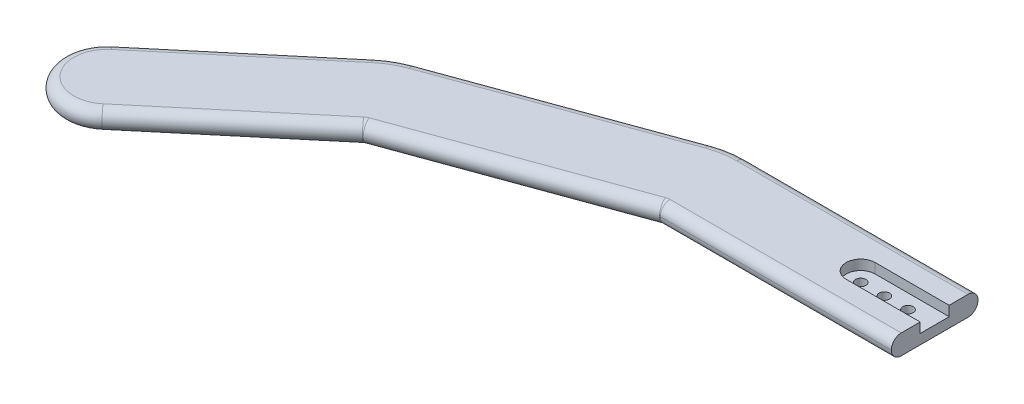
from build123d import *

# Parameters (mm, degrees)
SKETCH1_W           = 25.4
SKETCH1_H           = 9.525
BOSS_EXTRUDE1_DEPTH = 1.0922
BOSS_EXTRUDE2_DEPTH = 1.0922
FILLET1_R           = 1.0922
SKETCH3_R           = 0.575
CUT_EXTRUDE1_DEPTH  = 28.149190151
REVOLVE1_ANGLE      = 20
BOSS_EXTRUDE3_DEPTH = 25.4
REVOLVE2_ANGLE      = 20
BOSS_EXTRUDE4_DEPTH = 20.32
REVOLVE3_ANGLE      = 180


with BuildPart() as part:
    # Sketch1 → Boss-Extrude1 (new body)
    with BuildSketch(Plane(origin=(0, 0, 0), x_dir=(1, 0, 0), z_dir=(0, 1, 0))):
        with Locations((-12.7, -4.7625)):
            Rectangle(SKETCH1_W, SKETCH1_H)
    extrude(amount=BOSS_EXTRUDE1_DEPTH)

    # Sketch2 → Boss-Extrude2 (add)
    with BuildSketch(Plane(origin=(0, 1.0922, 0), x_dir=(1, 0, 0), z_dir=(0, 1, 0))):
        with BuildLine():
            Line((-8.128, -3.16865), (0, -3.16865))
            Line((0, -3.16865), (0, 0))
            Line((0, 0), (-25.4, 0))
            Line((-25.4, 0), (-25.4, -9.525))
            Line((-25.4, -9.525), (0, -9.525))
            Line((0, -9.525), (0, -6.35635))
            Line((0, -6.35635), (-8.128, -6.35635))
            ThreePointArc((-8.128, -6.35635), (-9.72185, -4.7625), (-8.128, -3.16865))
        make_face()
    extrude(amount=BOSS_EXTRUDE2_DEPTH)

    # Fillet1
    fillet1_edges = [part.edges().sort_by_distance(p)[0] for p in [
        (-12.7, 0, 0),
        (-12.7, 2.1844, 0),
        (-12.7, 0, 9.525),
        (-12.7, 2.1844, 9.525),
    ]]
    fillet(fillet1_edges, radius=FILLET1_R - 0.0001)  # a hair under: the kernel refuses the full size

    # Sketch3 → Cut-Extrude1 (cut, through all)
    with BuildSketch(Plane(origin=(0, 1.0922, 0), x_dir=(1, 0, 0), z_dir=(0, 1, 0))):
        with Locations(Location((-8.128, -4.7625, 0), (0, 0, 270))):
            Circle(SKETCH3_R)
        with Locations(Location((-5.528, -4.7625, 0), (0, 0, 270))):
            Circle(SKETCH3_R)
        with Locations(Location((-2.928, -4.7625, 0), (0, 0, 270))):
            Circle(SKETCH3_R)
    extrude(amount=-CUT_EXTRUDE1_DEPTH, mode=Mode.SUBTRACT)

    # Sketch5 → Revolve1 (revolve)
    with BuildSketch(Plane.ZY.offset(25.4)):
        with BuildLine():
            Line((1.0922, 0), (8.4328, 0))
            ThreePointArc((8.4328, 0), (9.205102026, 0.319897974), (9.525, 1.0922))
            ThreePointArc((9.525, 1.0922), (9.205102026, 1.864502026), (8.4328, 2.1844))
            Line((8.4328, 2.1844), (1.0922, 2.1844))
            ThreePointArc((1.0922, 2.1844), (0.319897974, 1.864502026), (0, 1.0922))
            ThreePointArc((0, 1.0922), (0.319897974, 0.319897974), (1.0922, 0))
        make_face()
    revolve(axis=Axis((-25.4, 2.1844, 9.7028), (0, 1, 0)), revolution_arc=REVOLVE1_ANGLE)

    # Sketch7 → Boss-Extrude3 (add)
    with BuildSketch(Plane(origin=(-25.547184237, 0, 9.298414632), x_dir=(0.34202014332566943, 0, 0.9396926207859082), z_dir=(-0.9396926207859082, 0, 0.34202014332566943))):
        with BuildLine():
            Line((-8.18026208, 0), (-0.83966208, 0))
            ThreePointArc((-0.83966208, 0), (0.25253792, 1.0922), (-0.83966208, 2.1844))
            Line((-0.83966208, 2.1844), (-8.18026208, 2.1844))
            ThreePointArc((-8.18026208, 2.1844), (-9.27246208, 1.0922), (-8.18026208, 0))
        make_face()
    extrude(amount=BOSS_EXTRUDE3_DEPTH)

    # Sketch9 → Revolve2 (revolve)
    with BuildSketch(Plane(origin=(-49.415376805, 0, 17.985726272), x_dir=(0.34202014332566943, 0, 0.9396926207859082), z_dir=(-0.9396926207859082, 0, 0.34202014332566943))):
        with BuildLine():
            Line((-8.18026208, 0), (-0.83966208, 0))
            ThreePointArc((-0.83966208, 0), (0.25253792, 1.0922), (-0.83966208, 2.1844))
            Line((-0.83966208, 2.1844), (-8.18026208, 2.1844))
            ThreePointArc((-8.18026208, 2.1844), (-9.27246208, 1.0922), (-8.18026208, 0))
        make_face()
    revolve(axis=Axis((-49.268192568, 2.1844, 18.39011164), (0, 1, 0)), revolution_arc=REVOLVE2_ANGLE)

    # Sketch10 → Boss-Extrude4 (add)
    with BuildSketch(Plane(origin=(-37.967124473, 0, 31.858200142), x_dir=(0.6427876096865406, 0, 0.7660444431189771), z_dir=(-0.766044443118977, 0, 0.6427876096865405))):
        with BuildLine():
            Line((-26.191940904, 0), (-18.851340904, 0))
            ThreePointArc((-18.851340904, 0), (-17.759140904, 1.0922), (-18.851340904, 2.1844))
            Line((-18.851340904, 2.1844), (-26.191940904, 2.1844))
            ThreePointArc((-26.191940904, 2.1844), (-27.284140904, 1.0922), (-26.191940904, 0))
        make_face()
    extrude(amount=BOSS_EXTRUDE4_DEPTH)

    # Sketch11 → Revolve3 (revolve)
    with BuildSketch(Plane(origin=(-53.533147557, 0, 44.919644371), x_dir=(0.6427876096865407, 0, 0.7660444431189769), z_dir=(-0.7660444431189769, 0, 0.6427876096865407))):
        with BuildLine():
            Line((-18.851340904, 2.1844), (-22.521640904, 2.1844))
            Line((-22.521640904, 2.1844), (-22.521640904, 0))
            Line((-22.521640904, 0), (-18.851340904, 0))
            ThreePointArc((-18.851340904, 0), (-17.759140904, 1.0922), (-18.851340904, 2.1844))
        make_face()
    revolve(axis=Axis((-68.00977928, 2.1844, 27.667066507), (0, -1, 0)), revolution_arc=REVOLVE3_ANGLE)


solid = part.part
